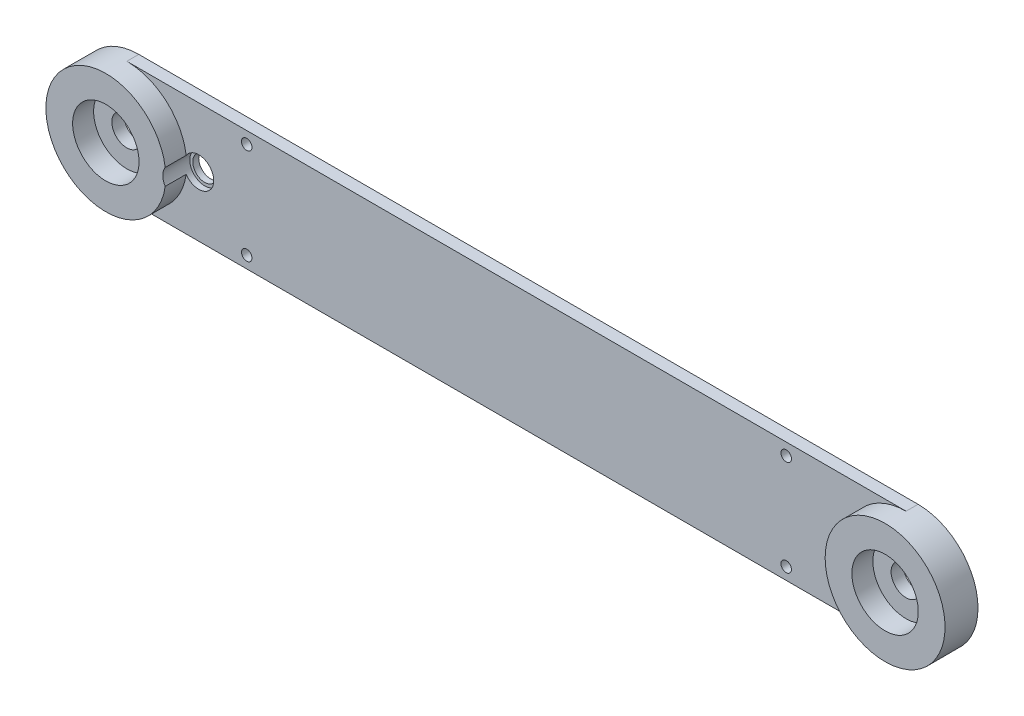
from build123d import *

# Parameters (mm, degrees)
AUFSATZ_LINEAR_AUSTRAGEN1_DEPTH      = 4
SKIZZE2_R                            = 20
SKIZZE2_R_2                          = 11.075
AUFSATZ_LINEAR_AUSTRAGEN2_DEPTH      = 7
SKIZZE3_R                            = 5
SCHNITT_LINEAR_AUSTRAGEN1_DEPTH      = 152.489273548
SKIZZE4_R                            = 1.75
SCHNITT_LINEAR_AUSTRAGEN2_DEPTH      = 152.489273548
SKIZZE5_R                            = 4
SCHNITT_LINEAR_AUSTRAGEN3_DEPTH      = 152.726728034
SCHNITT_LINEAR_AUSTRAGEN4_DEPTH      = 152.489273548
SCHNITT_LINEAR_AUSTRAGEN4_DEPTH_BACK = 2
SKIZZE6_R                            = 5


with BuildPart() as part:
    # Skizze1 → Aufsatz-Linear austragen1 (new body)
    with BuildSketch(Plane.XY):
        with BuildLine():
            Line((-130, -20), (130, -20))
            ThreePointArc((130, -20), (150, 0), (130, 20))
            Line((130, 20), (-130, 20))
            ThreePointArc((-130, 20), (-150, 0), (-130, -20))
        make_face()
    extrude(amount=AUFSATZ_LINEAR_AUSTRAGEN1_DEPTH)

    # Skizze2 → Aufsatz-Linear austragen2 (add)
    with BuildSketch(Plane.XY.offset(4)):
        with Locations((-130, 0)):
            Circle(SKIZZE2_R)
        with Locations((-130, 0)):
            Circle(SKIZZE2_R_2, mode=Mode.SUBTRACT)
    aufsatz_linear_austragen2 = extrude(amount=AUFSATZ_LINEAR_AUSTRAGEN2_DEPTH)

    # Skizze3 → Schnitt-Linear austragen1 (cut, symmetric)
    with BuildSketch(Plane.XY.offset(4)):
        with Locations((-130, 0)):
            Circle(SKIZZE3_R)
    schnitt_linear_austragen1 = extrude(amount=SCHNITT_LINEAR_AUSTRAGEN1_DEPTH, both=True, mode=Mode.SUBTRACT)

    # Spiegeln1: Aufsatz-Linear austragen2, Schnitt-Linear austragen1 across plane
    add(aufsatz_linear_austragen2.mirror(Plane(origin=(0, 0, 0), x_dir=(0, 0, 1), z_dir=(1, 0, 0))))
    add(schnitt_linear_austragen1.mirror(Plane(origin=(0, 0, 0), x_dir=(0, 0, 1), z_dir=(1, 0, 0))), mode=Mode.SUBTRACT)

    # Skizze4 → Schnitt-Linear austragen2 (cut, through all)
    with BuildSketch(Plane.XY.offset(4)):
        with Locations((-90, 16)):
            Circle(SKIZZE4_R)
        with Locations((-90, -16)):
            Circle(SKIZZE4_R)
        with Locations((90, -16)):
            Circle(SKIZZE4_R)
        with Locations((90, 16)):
            Circle(SKIZZE4_R)
    extrude(amount=-SCHNITT_LINEAR_AUSTRAGEN2_DEPTH, mode=Mode.SUBTRACT)

    # Skizze5 → Schnitt-Linear austragen3 (cut, through all)
    with BuildSketch(Plane(origin=(0, 0, 0), x_dir=(-1, 0, 0), z_dir=(0, 0, -1))):
        with Locations((106, 0)):
            Circle(SKIZZE5_R)
    extrude(amount=-SCHNITT_LINEAR_AUSTRAGEN3_DEPTH, mode=Mode.SUBTRACT)

    # Skizze6 → Schnitt-Linear austragen4 (cut, two sides: drawn at the far end of the back side and taken through both)
    with BuildSketch(Plane.XY.offset(4).offset(-SCHNITT_LINEAR_AUSTRAGEN4_DEPTH_BACK)):
        with Locations((-106, 0)):
            Circle(SKIZZE6_R)
    extrude(amount=SCHNITT_LINEAR_AUSTRAGEN4_DEPTH + SCHNITT_LINEAR_AUSTRAGEN4_DEPTH_BACK, mode=Mode.SUBTRACT)


solid = part.part
